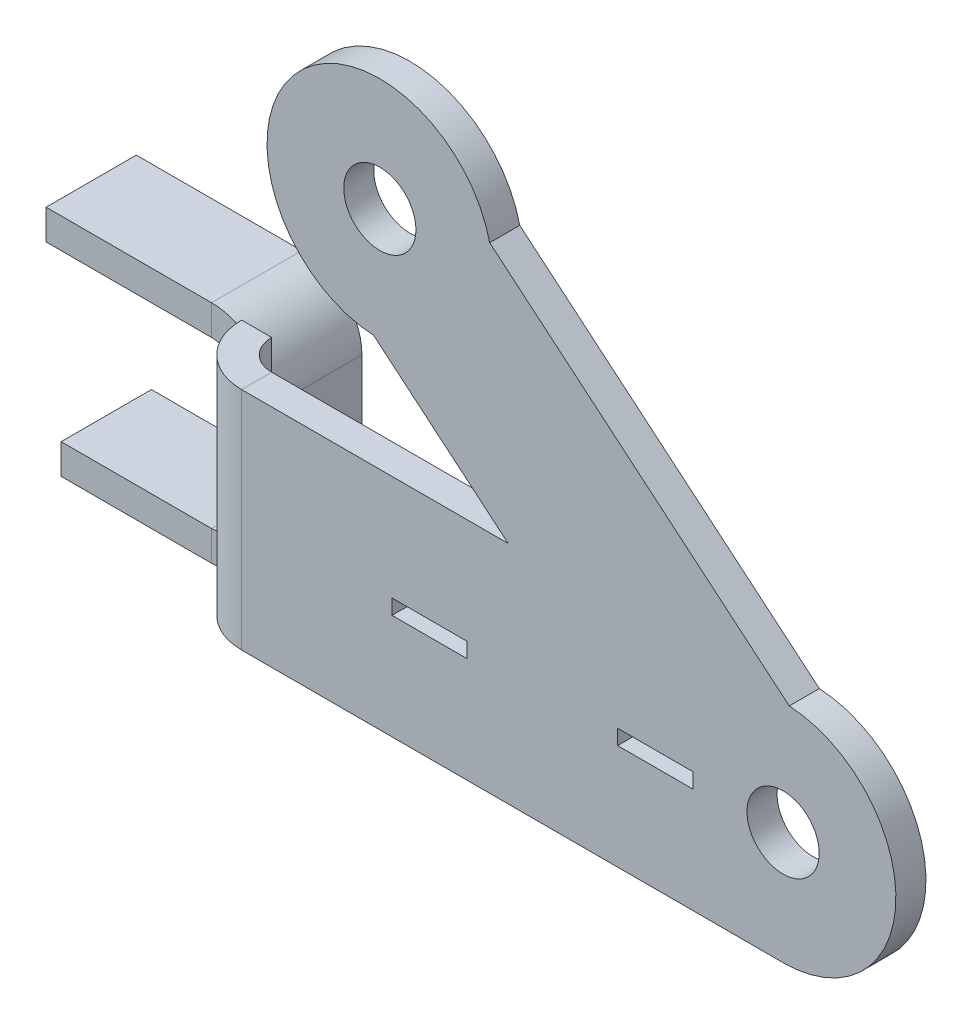
from build123d import *

# Parameters (mm, degrees)
SKETCH1_R                    = 2.4
BOSS_EXTRUDE1_DEPTH          = 2
SKETCH2_W                    = 5
SKETCH2_H                    = 1
CUT_EXTRUDE1_DEPTH           = 51.038525021
EDGE_FLANGE1_STRIP_W         = 12
EDGE_FLANGE1_STRIP_H         = 2
EDGE_FLANGE1_STRIP_CUT_DEPTH = 15
EDGE_FLANGE1_DEPTH           = 15
EDGE_FLANGE2_STRIP_W         = 12
EDGE_FLANGE2_STRIP_H         = 2
EDGE_FLANGE2_STRIP_CUT_DEPTH = 6
EDGE_FLANGE2_DEPTH           = 6
EDGE_FLANGE3_STRIP_W         = 12
EDGE_FLANGE3_STRIP_H         = 2
EDGE_FLANGE3_STRIP_CUT_DEPTH = 6
EDGE_FLANGE3_DEPTH           = 6


# Sheet-metal steps are written as plain solids
with BuildPart() as part:
    # Sketch1 → Boss-Extrude1 (new body)
    with BuildSketch(Plane.XY):
        with BuildLine():
            Line((0.409525664, 7.488810902), (-19.507629857, 24.201288754))
            ThreePointArc((-19.507629857, 24.201288754), (-32.556888833, 27.318473412), (-27.221081173, 15.008755437))
            Line((-27.221081173, 15.008755437), (-18.272494906, 7.5))
            Line((-18.272494906, 7.5), (-40, 7.5))
            Line((-40, 7.5), (-40, -7.5))
            Line((-40, -7.5), (0, -7.5))
            ThreePointArc((0, -7.5), (7.497202204, -0.204839245), (0.409525664, 7.488810902))
        make_face()
        Circle(SKETCH1_R, mode=Mode.SUBTRACT)
        with Locations((-26.811555509, 22.497566339)):
            Circle(SKETCH1_R, mode=Mode.SUBTRACT)
    extrude(amount=BOSS_EXTRUDE1_DEPTH)

    # Sketch2 → Cut-Extrude1 (cut, through all)
    with BuildSketch(Plane.XY.offset(2)):
        with Locations((-23.5, 0)):
            Rectangle(SKETCH2_W, SKETCH2_H)
        with Locations((-8.5, 0)):
            Rectangle(SKETCH2_W, SKETCH2_H)
    extrude(amount=-CUT_EXTRUDE1_DEPTH, mode=Mode.SUBTRACT)

    # Edge-Flange1 strip (across the edge) → Edge-Flange1 strip cut (cut)
    with BuildSketch(Plane(origin=(-40, -7.5, 0), x_dir=(1, 0, 0), z_dir=(0, 1, 0))):
        with Locations((-2, -1)):
            Rectangle(EDGE_FLANGE1_STRIP_W, EDGE_FLANGE1_STRIP_H)
    extrude(amount=EDGE_FLANGE1_STRIP_CUT_DEPTH, mode=Mode.SUBTRACT)

    # Edge-Flange1 section (across the edge) → Edge-Flange1 (add)
    with BuildSketch(Plane(origin=(-40, -7.5, 0), x_dir=(1, 0, 0), z_dir=(0, 1, 0))):
        with BuildLine():
            Line((0, 2), (0, 8))
            Line((0, 8), (2, 8))
            Line((2, 8), (2, 2))
            ThreePointArc((2, 2), (2.585786438, 0.585786438), (4, 0))
            Line((4, 0), (4, -2))
            ThreePointArc((4, -2), (1.171572875, -0.828427125), (0, 2))
        make_face()
    extrude(amount=EDGE_FLANGE1_DEPTH)

    # Edge-Flange2 strip (across the edge) → Edge-Flange2 strip cut (cut)
    with BuildSketch(Plane(origin=(-40, 7.5, -2), x_dir=(0, -1, 0), z_dir=(0, 0, -1))):
        with Locations((-2, -1)):
            Rectangle(EDGE_FLANGE2_STRIP_W, EDGE_FLANGE2_STRIP_H)
    extrude(amount=EDGE_FLANGE2_STRIP_CUT_DEPTH, mode=Mode.SUBTRACT)

    # Edge-Flange2 section (across the edge) → Edge-Flange2 (add)
    with BuildSketch(Plane(origin=(-40, 7.5, -2), x_dir=(0, -1, 0), z_dir=(0, 0, -1))):
        with BuildLine():
            Line((0, 2), (0, 13))
            Line((0, 13), (2, 13))
            Line((2, 13), (2, 2))
            ThreePointArc((2, 2), (2.585786438, 0.585786438), (4, 0))
            Line((4, 0), (4, -2))
            ThreePointArc((4, -2), (1.171572875, -0.828427125), (0, 2))
        make_face()
    extrude(amount=EDGE_FLANGE2_DEPTH)

    # Edge-Flange3 strip (across the edge) → Edge-Flange3 strip cut (cut)
    with BuildSketch(Plane(origin=(-40, -7.5, -8), x_dir=(0, 1, 0), z_dir=(0, 0, 1))):
        with Locations((-2, -1)):
            Rectangle(EDGE_FLANGE3_STRIP_W, EDGE_FLANGE3_STRIP_H)
    extrude(amount=EDGE_FLANGE3_STRIP_CUT_DEPTH, mode=Mode.SUBTRACT)

    # Edge-Flange3 section (across the edge) → Edge-Flange3 (add)
    with BuildSketch(Plane(origin=(-40, -7.5, -8), x_dir=(0, 1, 0), z_dir=(0, 0, 1))):
        with BuildLine():
            Line((0, 2), (0, 12))
            Line((0, 12), (2, 12))
            Line((2, 12), (2, 2))
            ThreePointArc((2, 2), (2.585786438, 0.585786438), (4, 0))
            Line((4, 0), (4, -2))
            ThreePointArc((4, -2), (1.171572875, -0.828427125), (0, 2))
        make_face()
    extrude(amount=EDGE_FLANGE3_DEPTH)


solid = part.part
